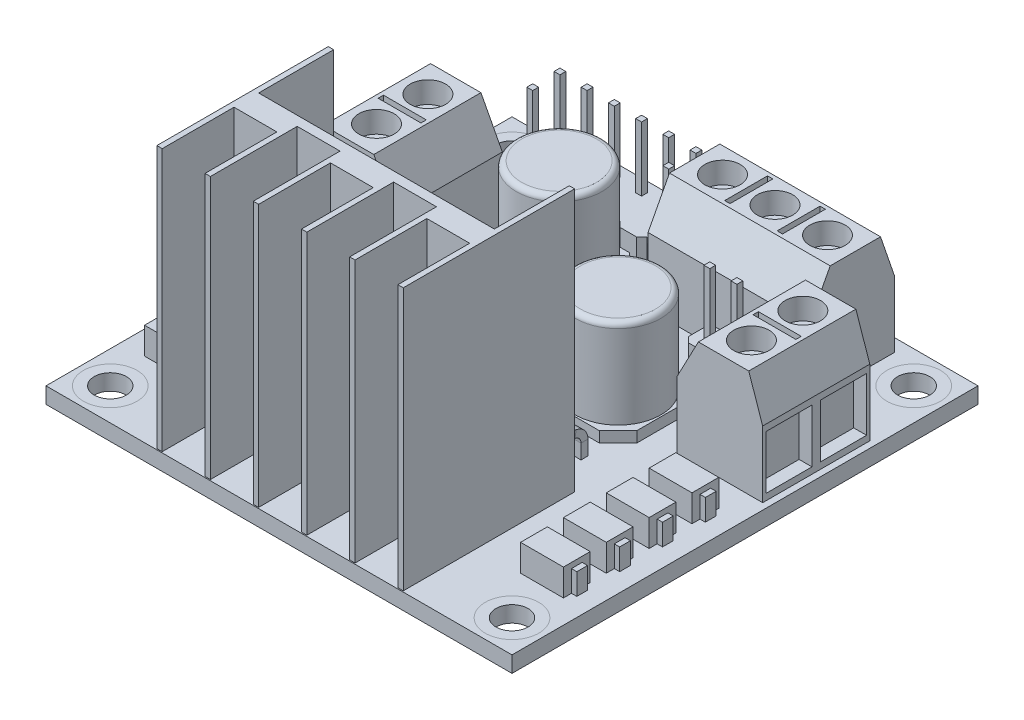
from build123d import *

# Parameters (mm, degrees)
SKETCH1_W              = 43.5
SKETCH1_H              = 43.5
SKETCH1_R              = 1.5
BOSS_EXTRUDE1_DEPTH    = 1.5
BOSS_EXTRUDE2_DEPTH    = 24.5
SKETCH4_R              = 1.5
CUT_EXTRUDE1_DEPTH     = 50.959508604
SKETCH5_W              = 4
SKETCH5_H              = 2.5
BOSS_EXTRUDE3_DEPTH    = 2.5
BOSS_EXTRUDE8_START    = -4.5
SKETCH10_W             = 1
SKETCH10_H             = 2
BOSS_EXTRUDE8_DEPTH    = 5
LPATTERN1_COUNT        = 4
LPATTERN1_PITCH        = 4
SKETCH6_W              = 15
SKETCH6_H              = 8
BOSS_EXTRUDE4_DEPTH    = 10
CHAMFER1_SIZE          = 3.8
CHAMFER1_SIZE2         = 1.3
CHAMFER2_SIZE          = 3.8
CHAMFER2_SIZE2         = 2
SKETCH7_R              = 1.65
CUT_EXTRUDE2_DEPTH     = 2
SKETCH11_W             = 4.3
SKETCH11_H             = 5
CUT_EXTRUDE3_DEPTH     = 1.2
SKETCH21_W             = 0.5
SKETCH21_H             = 4
CUT_EXTRUDE4_DEPTH     = 5
SKETCH22_W             = 8
SKETCH22_H             = 10
BOSS_EXTRUDE13_DEPTH   = 10
CHAMFER5_SIZE          = 3.8
CHAMFER5_SIZE2         = 1.3
CHAMFER6_SIZE          = 3.8
CHAMFER6_SIZE2         = 2
SKETCH23_R             = 1.65
CUT_EXTRUDE5_DEPTH     = 2
SKETCH24_W             = 4
SKETCH24_H             = 0.5
CUT_EXTRUDE6_DEPTH     = 5
SKETCH25_W             = 4.3
SKETCH25_H             = 5
CUT_EXTRUDE7_DEPTH     = 1.2
SKETCH8_R              = 1.75
BOSS_EXTRUDE5_DEPTH    = 1.6
CHAMFER3_SIZE          = 1
SKETCH9_W              = 20
SKETCH9_H              = 9.5
BOSS_EXTRUDE7_DEPTH    = 3.2
CHAMFER4_SIZE          = 3.2
CHAMFER4_SIZE_2        = 0.279963723
SKETCH16_W             = 0.65
SKETCH16_H             = 0.65
LPATTERN4_COUNT        = 8
LPATTERN4_PITCH        = 2.54
LPATTERN5_START        = -5.405
LPATTERN5_DEPTH        = 0.65
LPATTERN5_START_2      = -2.865
LPATTERN5_2_DEPTH      = 0.65
LPATTERN5_START_3      = -0.325
LPATTERN5_3_DEPTH      = 0.65
LPATTERN5_START_4      = 2.215
LPATTERN5_4_DEPTH      = 0.65
LPATTERN5_START_5      = 4.755
LPATTERN5_5_DEPTH      = 0.65
LPATTERN5_START_6      = 7.295
LPATTERN5_6_DEPTH      = 0.65
SKETCH18_W             = 0.65
SKETCH18_H             = 0.65
BOSS_EXTRUDE11_DEPTH   = 1
SKETCH20_R             = 4
BOSS_EXTRUDE12_DEPTH   = 8.3
FILLET1_R              = 0.5
BOSS_EXTRUDE9_DEPTH    = 2.5
LPATTERN2_COUNT        = 6
LPATTERN2_PITCH        = 2.54
SKETCH13_W             = 0.55
SKETCH13_H             = 0.55
BOSS_EXTRUDE10_DEPTH   = 6
LPATTERN3_COUNT        = 6
LPATTERN3_PITCH        = 2.54
LPATTERN3_COUNT_DIR2   = 2
LPATTERN3_PITCH_DIR2   = 2.54
SKETCH26_W             = 7.3
SKETCH26_H             = 6.5
BOSS_EXTRUDE14_DEPTH   = 0.8
CHAMFER7_SIZE          = 0.5
SKETCH27_W             = 6
SKETCH27_H             = 6.9
BOSS_EXTRUDE15_DEPTH   = 2.3
SKETCH28_W             = 0.9
SKETCH28_H             = 1.3
BOSS_EXTRUDE16_DEPTH   = 2.5
BOSS_EXTRUDE16_2_DEPTH = 2.5
BOSS_EXTRUDE17_DEPTH   = 2.5
SKETCH30_W             = 0.55
SKETCH30_H             = 0.55
BOSS_EXTRUDE18_DEPTH   = 6


with BuildPart() as part:
    # Sketch1 → Boss-Extrude1 (new body)
    with BuildSketch(Plane(origin=(0, 0, 0), x_dir=(1, 0, 0), z_dir=(0, 1, 0))):
        Rectangle(SKETCH1_W, SKETCH1_H)
        with Locations(Location((-18.75, 18.75, 0), (0, 0, 270))):
            Circle(SKETCH1_R, mode=Mode.SUBTRACT)
        with Locations(Location((18.75, 18.75, 0), (0, 0, 270))):
            Circle(SKETCH1_R, mode=Mode.SUBTRACT)
        with Locations(Location((18.75, -18.75, 0), (0, 0, 270))):
            Circle(SKETCH1_R, mode=Mode.SUBTRACT)
        with Locations(Location((-18.75, -18.75, 0), (0, 0, 270))):
            Circle(SKETCH1_R, mode=Mode.SUBTRACT)
    extrude(amount=BOSS_EXTRUDE1_DEPTH)



with BuildPart() as body_2:
    # Sketch3 → Boss-Extrude2 (new body)
    with BuildSketch(Plane(origin=(0, 1.5, 0), x_dir=(1, 0, 0), z_dir=(0, 1, 0))):
        Polygon((0, -12.65), (0, -14.95), (-2, -14.95), (-2, -21.65), (-2.5, -21.65), (-2.5, -13.55), (-6.5, -13.55), (-6.5, -21.65), (-7, -21.65), (-7, -14.95), (-11, -14.95), (-11, -21.65), (-11.5, -21.65), (-11.5, -5.65), (-11, -5.65), (-11, -12.65), align=None)
    boss_extrude2 = extrude(amount=BOSS_EXTRUDE2_DEPTH)

    # Mirror2: Boss-Extrude2 across Right Plane
    add(boss_extrude2.mirror(Plane(origin=(0, 0, 0), x_dir=(0, 0, -1), z_dir=(1, 0, 0))))

    # Sketch4 → Cut-Extrude1 (cut, through all)
    with BuildSketch(Plane.XY.offset(14.95)):
        with Locations((0, 20)):
            Circle(SKETCH4_R)
    extrude(amount=-CUT_EXTRUDE1_DEPTH, mode=Mode.SUBTRACT)


with BuildPart() as body_3:
    # Sketch5 → Boss-Extrude3 (new body)
    with BuildSketch(Plane(origin=(0, 1.5, 0), x_dir=(1, 0, 0), z_dir=(0, 1, 0))):
        with Locations((-17.55, -13.5)):
            Rectangle(SKETCH5_W, SKETCH5_H)
    extrude(amount=BOSS_EXTRUDE3_DEPTH)

    # Sketch10 → Boss-Extrude8 (add)
    with BuildSketch(Plane.ZY.offset(19.55).offset(BOSS_EXTRUDE8_START)):
        with Locations((13.5, 2.5)):
            Rectangle(SKETCH10_W, SKETCH10_H)
    extrude(amount=BOSS_EXTRUDE8_DEPTH)


with BuildPart() as lpattern1_1:
    # LPattern1: pattern copy
    add(body_3.part.moved(Location(Vector(0, 0, -1) * (1 * LPATTERN1_PITCH))))


with BuildPart() as lpattern1_2:
    # LPattern1: pattern copy
    add(body_3.part.moved(Location(Vector(0, 0, -1) * (2 * LPATTERN1_PITCH))))


with BuildPart() as lpattern1_3:
    # LPattern1: pattern copy
    add(body_3.part.moved(Location(Vector(0, 0, -1) * (3 * LPATTERN1_PITCH))))


with BuildPart() as body_7:
    # Mirror3: mirrored copy
    add(body_3.part.mirror(Plane(origin=(0, 0, 0), x_dir=(0, 0, 1), z_dir=(1, 0, 0))))


with BuildPart() as body_8:
    # Mirror3 2: mirrored copy
    add(lpattern1_1.part.mirror(Plane(origin=(0, 0, 0), x_dir=(0, 0, 1), z_dir=(1, 0, 0))))


with BuildPart() as body_9:
    # Mirror3 3: mirrored copy
    add(lpattern1_2.part.mirror(Plane(origin=(0, 0, 0), x_dir=(0, 0, 1), z_dir=(1, 0, 0))))


with BuildPart() as body_10:
    # Mirror3 4: mirrored copy
    add(lpattern1_3.part.mirror(Plane(origin=(0, 0, 0), x_dir=(0, 0, 1), z_dir=(1, 0, 0))))


with BuildPart() as body_11:
    # Sketch6 → Boss-Extrude4 (new body)
    with BuildSketch(Plane(origin=(0, 1.5, 0), x_dir=(1, 0, 0), z_dir=(0, 1, 0))):
        with Locations((7.65, 16.55)):
            Rectangle(SKETCH6_W, SKETCH6_H)
    extrude(amount=BOSS_EXTRUDE4_DEPTH)

    # Chamfer1
    chamfer1_edges = [body_11.edges().sort_by_distance(p)[0] for p in [
        (7.65, 11.5, -20.55),
    ]]
    chamfer1_side = [body_11.faces().sort_by_distance(p)[0] for p in [
        (7.65, 6.5, -20.55),
    ]]
    chamfer(chamfer1_edges, length=CHAMFER1_SIZE, length2=CHAMFER1_SIZE2, reference=chamfer1_side[0])

    # Chamfer2
    chamfer2_edges = [body_11.edges().sort_by_distance(p)[0] for p in [
        (7.65, 11.5, -12.55),
    ]]
    chamfer2_side = [body_11.faces().sort_by_distance(p)[0] for p in [
        (7.65, 6.5, -12.55),
    ]]
    chamfer(chamfer2_edges, length=CHAMFER2_SIZE, length2=CHAMFER2_SIZE2, reference=chamfer2_side[0])

    # Sketch7 → Cut-Extrude2 (cut)
    with BuildSketch(Plane(origin=(0, 11.5, 0), x_dir=(1, 0, 0), z_dir=(0, 1, 0))):
        with Locations(Location((12.55, 16.9, 0), (0, 0, 270))):
            Circle(SKETCH7_R)
        with Locations(Location((7.65, 16.9, 0), (0, 0, 270))):
            Circle(SKETCH7_R)
        with Locations(Location((2.75, 16.9, 0), (0, 0, 270))):
            Circle(SKETCH7_R)
    extrude(amount=-CUT_EXTRUDE2_DEPTH, mode=Mode.SUBTRACT)

    # Sketch11 → Cut-Extrude3 (cut)
    with BuildSketch(Plane(origin=(0, 0, -20.55), x_dir=(-1, 0, 0), z_dir=(0, 0, -1))):
        with Locations((-12.55, 4.6)):
            Rectangle(SKETCH11_W, SKETCH11_H)
        with Locations((-7.65, 4.6)):
            Rectangle(SKETCH11_W, SKETCH11_H)
        with Locations((-2.75, 4.6)):
            Rectangle(SKETCH11_W, SKETCH11_H)
    extrude(amount=-CUT_EXTRUDE3_DEPTH, mode=Mode.SUBTRACT)

    # Sketch21 → Cut-Extrude4 (cut)
    with BuildSketch(Plane(origin=(0, 11.5, 0), x_dir=(1, 0, 0), z_dir=(0, 1, 0))):
        with Locations((10.1, 16.9)):
            Rectangle(SKETCH21_W, SKETCH21_H)
        with Locations((5.2, 16.9)):
            Rectangle(SKETCH21_W, SKETCH21_H)
    extrude(amount=-CUT_EXTRUDE4_DEPTH, mode=Mode.SUBTRACT)


with BuildPart() as body_12:
    # Sketch22 → Boss-Extrude13 (new body)
    with BuildSketch(Plane(origin=(0, 1.5, 0), x_dir=(1, 0, 0), z_dir=(0, 1, 0))):
        with Locations((-17.15, 7.25)):
            Rectangle(SKETCH22_W, SKETCH22_H)
    extrude(amount=BOSS_EXTRUDE13_DEPTH)

    # Chamfer5
    chamfer5_edges = [body_12.edges().sort_by_distance(p)[0] for p in [
        (-21.15, 11.5, -7.25),
    ]]
    chamfer5_side = [body_12.faces().sort_by_distance(p)[0] for p in [
        (-21.15, 6.5, -7.25),
    ]]
    chamfer(chamfer5_edges, length=CHAMFER5_SIZE, length2=CHAMFER5_SIZE2, reference=chamfer5_side[0])

    # Chamfer6
    chamfer6_edges = [body_12.edges().sort_by_distance(p)[0] for p in [
        (-13.15, 11.5, -7.25),
    ]]
    chamfer6_side = [body_12.faces().sort_by_distance(p)[0] for p in [
        (-13.15, 6.5, -7.25),
    ]]
    chamfer(chamfer6_edges, length=CHAMFER6_SIZE, length2=CHAMFER6_SIZE2, reference=chamfer6_side[0])

    # Sketch23 → Cut-Extrude5 (cut)
    with BuildSketch(Plane(origin=(0, 11.5, 0), x_dir=(1, 0, 0), z_dir=(0, 1, 0))):
        with Locations(Location((-17.5, 9.65, 0), (0, 0, 270))):
            Circle(SKETCH23_R)
        with Locations(Location((-17.5, 4.85, 0), (0, 0, 270))):
            Circle(SKETCH23_R)
    extrude(amount=-CUT_EXTRUDE5_DEPTH, mode=Mode.SUBTRACT)

    # Sketch24 → Cut-Extrude6 (cut)
    with BuildSketch(Plane(origin=(0, 11.5, 0), x_dir=(1, 0, 0), z_dir=(0, 1, 0))):
        with Locations((-17.5, 7.25)):
            Rectangle(SKETCH24_W, SKETCH24_H)
    extrude(amount=-CUT_EXTRUDE6_DEPTH, mode=Mode.SUBTRACT)

    # Sketch25 → Cut-Extrude7 (cut)
    with BuildSketch(Plane.ZY.offset(21.15)):
        with Locations((-9.8, 4.6)):
            Rectangle(SKETCH25_W, SKETCH25_H)
        with Locations((-4.7, 4.6)):
            Rectangle(SKETCH25_W, SKETCH25_H)
    extrude(amount=-CUT_EXTRUDE7_DEPTH, mode=Mode.SUBTRACT)


with BuildPart() as body_13:
    # Mirror5: mirrored copy
    add(body_12.part.mirror(Plane(origin=(0, 0, 0), x_dir=(0, 0, 1), z_dir=(1, 0, 0))))


with BuildPart() as body_14:
    # Sketch8 → Boss-Extrude5 (new body)
    with BuildSketch(Plane(origin=(0, 0, 12.65), x_dir=(-1, 0, 0), z_dir=(0, 0, -1))):
        Polygon((-8, 23), (8, 23), (10, 21), (10, 7), (-10, 7), (-10, 21), align=None)
        with Locations((0, 20)):
            Circle(SKETCH8_R, mode=Mode.SUBTRACT)
    extrude(amount=BOSS_EXTRUDE5_DEPTH)

    # Chamfer3
    chamfer3_edges = [body_14.edges().sort_by_distance(p)[0] for p in [
        (1.75, 20, 11.05),
    ]]
    chamfer(chamfer3_edges, length=CHAMFER3_SIZE)


with BuildPart() as body_15:
    # Sketch9 → Boss-Extrude7 (new body)
    with BuildSketch(Plane(origin=(0, 0, 11.05), x_dir=(-1, 0, 0), z_dir=(0, 0, -1))):
        with Locations((0, 11.75)):
            Rectangle(SKETCH9_W, SKETCH9_H)
    extrude(amount=BOSS_EXTRUDE7_DEPTH)

    # Chamfer4
    # the kernel refuses this chamfer: 3.2, 0.279963723 mm, written as the material it takes off along each edge
    with BuildSketch(Plane(origin=(-18.318829055, 16.5, 7.85), x_dir=(0, 0, 1), z_dir=(1, 0, 0)), Plane(origin=(18.318829055, 7, 7.85), x_dir=(0, 0, 1), z_dir=(-1, 0, 0))) as chamfer4_piece_1:
        Polygon((CHAMFER4_SIZE, 0), (0, CHAMFER4_SIZE_2 * 1.00000000101), (0, 0), align=None)
    extrude(amount=36.637658111, mode=Mode.SUBTRACT)
    with BuildSketch(Plane(origin=(-10, -1.318829055, 7.85), x_dir=(0, 0, 1), z_dir=(0, 1, 0)), Plane(origin=(10, 24.818829055, 7.85), x_dir=(0, 0, 1), z_dir=(0, -1, 0))) as chamfer4_piece_2:
        Polygon((CHAMFER4_SIZE, 0), (0, CHAMFER4_SIZE_2 * 1.00000000101), (0, 0), align=None)
    extrude(amount=26.137658111, mode=Mode.SUBTRACT)


with BuildPart() as part_1:
    add(part.part)

    add(body_15.part)  # Sweep1 merges body 15
    # Sweep1: sweep along a path in Sketch15
    with BuildLine(Plane.ZY.offset(8.89)) as sweep1_path:
        Line((9.45, 7.139981862), (9.45, 5.776234994))
        ThreePointArc((9.45, 5.776234994), (9.216044443, 5.133447385), (8.623648178, 4.791427241))
        Line((8.623648178, 4.791427241), (3.276351822, 3.84855462))
        ThreePointArc((3.276351822, 3.84855462), (2.683955557, 3.506534477), (2.45, 2.863746867))
        Line((2.45, 2.863746867), (2.45, 1.5))
    # Sketch16 → Sweep1 (sweep)
    with BuildSketch(Plane(origin=(0, 1.5, 0), x_dir=(1, 0, 0), z_dir=(0, 1, 0))):
        with Locations((-8.89, -2.45)):
            Rectangle(SKETCH16_W, SKETCH16_H)
    sweep1 = sweep(path=sweep1_path.line)

    # LPattern4: Sweep1 ×8
    with Locations(*[(i * LPATTERN4_PITCH, 0, 0) for i in range(1, LPATTERN4_COUNT)]):
        add(sweep1)

    # LPattern5: read off the stored shape, not the designer's step
    # LPattern5 outline → LPattern5 (add)
    with BuildSketch(Plane.YZ.offset(LPATTERN5_START)):
        with BuildLine():
            Line((7.139981862, 9.125), (7.139981862, 9.45))
            Line((7.139981862, 9.45), (7.111548046, 9.775))
            Line((7.111548046, 9.775), (5.776234994, 9.775))
            ThreePointArc((5.776234994, 9.775), (4.924541412, 9.465008887), (4.471364722, 8.680083835))
            Line((4.471364722, 8.680083835), (4.424233162, 8.41278748))
            ThreePointArc((4.424233162, 8.41278748), (4.193369566, 8.012920001), (3.759487929, 7.855))
            Line((3.759487929, 7.855), (1.5, 7.855))
            Line((1.5, 7.855), (1.5, 7.205))
            Line((1.5, 7.205), (3.759487929, 7.205))
            ThreePointArc((3.759487929, 7.205), (4.611181512, 7.514991113), (5.064358202, 8.299916165))
            Line((5.064358202, 8.299916165), (5.111489761, 8.56721252))
            ThreePointArc((5.111489761, 8.56721252), (5.342353358, 8.967079999), (5.776234994, 9.125))
            Line((5.776234994, 9.125), (7.139981862, 9.125))
        make_face()
    extrude(amount=LPATTERN5_DEPTH)

    # LPattern5 2 outline → LPattern5 2 (add)
    with BuildSketch(Plane.YZ.offset(LPATTERN5_START_2)):
        with BuildLine():
            Line((7.139981862, 9.125), (7.139981862, 9.45))
            Line((7.139981862, 9.45), (7.111548046, 9.775))
            Line((7.111548046, 9.775), (5.776234994, 9.775))
            ThreePointArc((5.776234994, 9.775), (4.924541412, 9.465008887), (4.471364722, 8.680083835))
            Line((4.471364722, 8.680083835), (4.424233162, 8.41278748))
            ThreePointArc((4.424233162, 8.41278748), (4.193369566, 8.012920001), (3.759487929, 7.855))
            Line((3.759487929, 7.855), (1.5, 7.855))
            Line((1.5, 7.855), (1.5, 7.205))
            Line((1.5, 7.205), (3.759487929, 7.205))
            ThreePointArc((3.759487929, 7.205), (4.611181512, 7.514991113), (5.064358202, 8.299916165))
            Line((5.064358202, 8.299916165), (5.111489761, 8.56721252))
            ThreePointArc((5.111489761, 8.56721252), (5.342353358, 8.967079999), (5.776234994, 9.125))
            Line((5.776234994, 9.125), (7.139981862, 9.125))
        make_face()
    extrude(amount=LPATTERN5_2_DEPTH)

    # LPattern5 3 outline → LPattern5 3 (add)
    with BuildSketch(Plane.YZ.offset(LPATTERN5_START_3)):
        with BuildLine():
            Line((7.139981862, 9.125), (7.139981862, 9.45))
            Line((7.139981862, 9.45), (7.111548046, 9.775))
            Line((7.111548046, 9.775), (5.776234994, 9.775))
            ThreePointArc((5.776234994, 9.775), (4.924541412, 9.465008887), (4.471364722, 8.680083835))
            Line((4.471364722, 8.680083835), (4.424233162, 8.41278748))
            ThreePointArc((4.424233162, 8.41278748), (4.193369566, 8.012920001), (3.759487929, 7.855))
            Line((3.759487929, 7.855), (1.5, 7.855))
            Line((1.5, 7.855), (1.5, 7.205))
            Line((1.5, 7.205), (3.759487929, 7.205))
            ThreePointArc((3.759487929, 7.205), (4.611181512, 7.514991113), (5.064358202, 8.299916165))
            Line((5.064358202, 8.299916165), (5.111489761, 8.56721252))
            ThreePointArc((5.111489761, 8.56721252), (5.342353358, 8.967079999), (5.776234994, 9.125))
            Line((5.776234994, 9.125), (7.139981862, 9.125))
        make_face()
    extrude(amount=LPATTERN5_3_DEPTH)

    # LPattern5 4 outline → LPattern5 4 (add)
    with BuildSketch(Plane.YZ.offset(LPATTERN5_START_4)):
        with BuildLine():
            Line((7.139981862, 9.125), (7.139981862, 9.45))
            Line((7.139981862, 9.45), (7.111548046, 9.775))
            Line((7.111548046, 9.775), (5.776234994, 9.775))
            ThreePointArc((5.776234994, 9.775), (4.924541412, 9.465008887), (4.471364722, 8.680083835))
            Line((4.471364722, 8.680083835), (4.424233162, 8.41278748))
            ThreePointArc((4.424233162, 8.41278748), (4.193369566, 8.012920001), (3.759487929, 7.855))
            Line((3.759487929, 7.855), (1.5, 7.855))
            Line((1.5, 7.855), (1.5, 7.205))
            Line((1.5, 7.205), (3.759487929, 7.205))
            ThreePointArc((3.759487929, 7.205), (4.611181512, 7.514991113), (5.064358202, 8.299916165))
            Line((5.064358202, 8.299916165), (5.111489761, 8.56721252))
            ThreePointArc((5.111489761, 8.56721252), (5.342353358, 8.967079999), (5.776234994, 9.125))
            Line((5.776234994, 9.125), (7.139981862, 9.125))
        make_face()
    extrude(amount=LPATTERN5_4_DEPTH)

    # LPattern5 5 outline → LPattern5 5 (add)
    with BuildSketch(Plane.YZ.offset(LPATTERN5_START_5)):
        with BuildLine():
            Line((7.139981862, 9.125), (7.139981862, 9.45))
            Line((7.139981862, 9.45), (7.111548046, 9.775))
            Line((7.111548046, 9.775), (5.776234994, 9.775))
            ThreePointArc((5.776234994, 9.775), (4.924541412, 9.465008887), (4.471364722, 8.680083835))
            Line((4.471364722, 8.680083835), (4.424233162, 8.41278748))
            ThreePointArc((4.424233162, 8.41278748), (4.193369566, 8.012920001), (3.759487929, 7.855))
            Line((3.759487929, 7.855), (1.5, 7.855))
            Line((1.5, 7.855), (1.5, 7.205))
            Line((1.5, 7.205), (3.759487929, 7.205))
            ThreePointArc((3.759487929, 7.205), (4.611181512, 7.514991113), (5.064358202, 8.299916165))
            Line((5.064358202, 8.299916165), (5.111489761, 8.56721252))
            ThreePointArc((5.111489761, 8.56721252), (5.342353358, 8.967079999), (5.776234994, 9.125))
            Line((5.776234994, 9.125), (7.139981862, 9.125))
        make_face()
    extrude(amount=LPATTERN5_5_DEPTH)

    # LPattern5 6 outline → LPattern5 6 (add)
    with BuildSketch(Plane.YZ.offset(LPATTERN5_START_6)):
        with BuildLine():
            Line((7.139981862, 9.125), (7.139981862, 9.45))
            Line((7.139981862, 9.45), (7.111548046, 9.775))
            Line((7.111548046, 9.775), (5.776234994, 9.775))
            ThreePointArc((5.776234994, 9.775), (4.924541412, 9.465008887), (4.471364722, 8.680083835))
            Line((4.471364722, 8.680083835), (4.424233162, 8.41278748))
            ThreePointArc((4.424233162, 8.41278748), (4.193369566, 8.012920001), (3.759487929, 7.855))
            Line((3.759487929, 7.855), (1.5, 7.855))
            Line((1.5, 7.855), (1.5, 7.205))
            Line((1.5, 7.205), (3.759487929, 7.205))
            ThreePointArc((3.759487929, 7.205), (4.611181512, 7.514991113), (5.064358202, 8.299916165))
            Line((5.064358202, 8.299916165), (5.111489761, 8.56721252))
            ThreePointArc((5.111489761, 8.56721252), (5.342353358, 8.967079999), (5.776234994, 9.125))
            Line((5.776234994, 9.125), (7.139981862, 9.125))
        make_face()
    extrude(amount=LPATTERN5_6_DEPTH)

    # Sweep2: sweep along a path in Sketch17
    with BuildLine(Plane.ZY.offset(7.62)) as sweep2_path:
        Line((9.45, 7.139981862), (9.45, 5.776234994))
        ThreePointArc((9.45, 5.776234994), (9.216044443, 5.133447385), (8.623648178, 4.791427241))
        Line((8.623648178, 4.791427241), (8.356351822, 4.744295682))
        ThreePointArc((8.356351822, 4.744295682), (7.763955557, 4.402275539), (7.53, 3.759487929))
        Line((7.53, 3.759487929), (7.53, 1.5))
    # Sketch18 → Sweep2 (sweep)
    with BuildSketch(Plane(origin=(0, 1.5, 0), x_dir=(1, 0, 0), z_dir=(0, 1, 0))):
        with Locations((-7.62, -7.53)):
            Rectangle(SKETCH18_W, SKETCH18_H)
    sweep(path=sweep2_path.line)


with BuildPart() as body_15_2:
    # Sketch19 → Boss-Extrude11 (new body)
    with BuildSketch(Plane(origin=(0, 1.5, 0), x_dir=(1, 0, 0), z_dir=(0, 1, 0))):
        Polygon((10.45, 1.2), (8.7, -0.55), (2.15, -0.55), (2.15, 7.75), (8.7, 7.75), (10.45, 6), align=None)
    extrude(amount=BOSS_EXTRUDE11_DEPTH)

    # Sketch20 → Boss-Extrude12 (add)
    with BuildSketch(Plane(origin=(0, 2.5, 0), x_dir=(1, 0, 0), z_dir=(0, 1, 0))):
        with Locations(Location((6.3, 3.6, 0), (0, 0, 90))):
            Circle(SKETCH20_R)
    extrude(amount=BOSS_EXTRUDE12_DEPTH)

    # Fillet1
    fillet1_edges = [body_15_2.edges().sort_by_distance(p)[0] for p in [
        (6.3, 10.8, 0.4),
    ]]
    fillet(fillet1_edges, radius=FILLET1_R)


with BuildPart() as body_16:
    # LPattern6: read off the stored shape, not the designer's step
    # LPattern6: copy of body 15 2
    add(body_15_2.part.moved(Location((-13, 0, -7.5))))


with BuildPart() as body_17:
    # Sketch12 → Boss-Extrude9 (new body)
    with BuildSketch(Plane(origin=(0, 1.5, 0), x_dir=(1, 0, 0), z_dir=(0, 1, 0))):
        Polygon((-15.45, 20.35), (-13.91, 20.35), (-13.41, 19.85), (-13.41, 15.85), (-13.91, 15.35), (-15.45, 15.35), (-15.95, 15.85), (-15.95, 19.85), align=None)
    boss_extrude9 = extrude(amount=BOSS_EXTRUDE9_DEPTH)

    # Sketch13 → Boss-Extrude10 (add)
    with BuildSketch(Plane(origin=(0, 4, 0), x_dir=(1, 0, 0), z_dir=(0, 1, 0))):
        with Locations((-14.68, 19.15)):
            Rectangle(SKETCH13_W, SKETCH13_H)
    boss_extrude10 = extrude(amount=BOSS_EXTRUDE10_DEPTH)



with BuildPart() as lpattern2_1:
    # LPattern2: pattern copy
    add(boss_extrude9.moved(Location(Vector(1, 0, 0) * (1 * LPATTERN2_PITCH))))


with BuildPart() as lpattern2_2:
    # LPattern2: pattern copy
    add(boss_extrude9.moved(Location(Vector(1, 0, 0) * (2 * LPATTERN2_PITCH))))


with BuildPart() as lpattern2_3:
    # LPattern2: pattern copy
    add(boss_extrude9.moved(Location(Vector(1, 0, 0) * (3 * LPATTERN2_PITCH))))


with BuildPart() as lpattern2_4:
    # LPattern2: pattern copy
    add(boss_extrude9.moved(Location(Vector(1, 0, 0) * (4 * LPATTERN2_PITCH))))


with BuildPart() as lpattern2_5:
    # LPattern2: pattern copy
    add(boss_extrude9.moved(Location(Vector(1, 0, 0) * (5 * LPATTERN2_PITCH))))


with BuildPart() as body_17_1:
    add(body_17.part)

    add(lpattern2_1.part)  # LPattern3 merges LPattern2_1

    add(lpattern2_2.part)  # LPattern3 merges LPattern2_2

    add(lpattern2_3.part)  # LPattern3 merges LPattern2_3

    add(lpattern2_4.part)  # LPattern3 merges LPattern2_4

    add(lpattern2_5.part)  # LPattern3 merges LPattern2_5
    # LPattern3: Boss-Extrude10 6 × 2, 4 skipped
    with Locations(*[(i * LPATTERN3_PITCH, 0, j * LPATTERN3_PITCH_DIR2) for i in range(LPATTERN3_COUNT) for j in range(LPATTERN3_COUNT_DIR2) if (i, j) not in ((0, 0), (1, 1), (2, 1), (3, 1), (4, 1))]):
        add(boss_extrude10)


with BuildPart() as body_18:
    # Sketch26 → Boss-Extrude14 (new body)
    with BuildSketch(Plane(origin=(0, 1.5, 0), x_dir=(1, 0, 0), z_dir=(0, 1, 0))):
        with Locations((-7.1, 2.5)):
            Rectangle(SKETCH26_W, SKETCH26_H)
    extrude(amount=BOSS_EXTRUDE14_DEPTH)

    # Chamfer7
    chamfer7_edges = [body_18.edges().sort_by_distance(p)[0] for p in [
        (-10.75, 1.9, 0.75),
        (-10.75, 1.9, -5.75),
    ]]
    chamfer(chamfer7_edges, length=CHAMFER7_SIZE)

    # Sketch27 → Boss-Extrude15 (add)
    with BuildSketch(Plane(origin=(0, 1.5, 0), x_dir=(1, 0, 0), z_dir=(0, 1, 0))):
        with Locations((-6.25, 2.5)):
            Rectangle(SKETCH27_W, SKETCH27_H)
    extrude(amount=BOSS_EXTRUDE15_DEPTH)


with BuildPart() as body_19:
    # Sketch28 → Boss-Extrude16 (new body)
    with BuildSketch(Plane(origin=(-3.25, 0, 0), x_dir=(0, 0, -1), z_dir=(1, 0, 0))):
        with Locations((-0.2, 2.15)):
            Rectangle(SKETCH28_W, SKETCH28_H)
    extrude(amount=BOSS_EXTRUDE16_DEPTH)


with BuildPart() as body_20:
    # Sketch28 → Boss-Extrude16 2 (new body)
    with BuildSketch(Plane(origin=(-3.25, 0, 0), x_dir=(0, 0, -1), z_dir=(1, 0, 0))):
        with Locations((5.2, 2.15)):
            Rectangle(SKETCH28_W, SKETCH28_H)
    extrude(amount=BOSS_EXTRUDE16_2_DEPTH)


with BuildPart() as body_21:
    # Sketch29 → Boss-Extrude17 (new body)
    with BuildSketch(Plane(origin=(0, 1.5, 0), x_dir=(1, 0, 0), z_dir=(0, 1, 0))):
        Polygon((11.75, 9.71), (11.25, 9.21), (7.25, 9.21), (6.75, 9.71), (6.75, 11.25), (7.25, 11.75), (11.25, 11.75), (11.75, 11.25), align=None)
    extrude(amount=BOSS_EXTRUDE17_DEPTH)

    # Sketch30 → Boss-Extrude18 (add)
    with BuildSketch(Plane(origin=(0, 4, 0), x_dir=(1, 0, 0), z_dir=(0, 1, 0))):
        with Locations((10.52, 10.48)):
            Rectangle(SKETCH30_W, SKETCH30_H)
        with Locations((7.98, 10.48)):
            Rectangle(SKETCH30_W, SKETCH30_H)
    extrude(amount=BOSS_EXTRUDE18_DEPTH)


solid = Compound([body_2.part, body_3.part, lpattern1_1.part, lpattern1_2.part, lpattern1_3.part, body_7.part, body_8.part, body_9.part, body_10.part, body_11.part, body_12.part, body_13.part, body_14.part, part_1.part, body_15_2.part, body_16.part, body_17_1.part, body_18.part, body_19.part, body_20.part, body_21.part])
